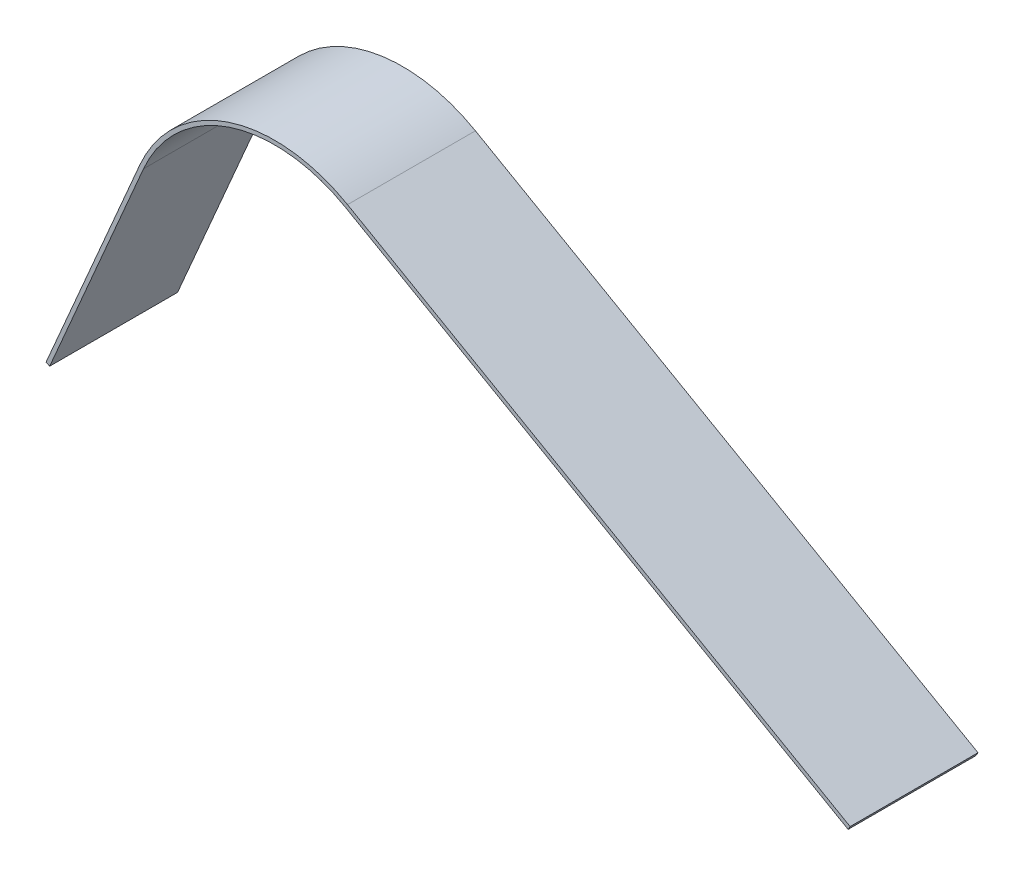
from build123d import *

# Parameters (mm, degrees)
BOSS_EXTRUDE1_DEPTH = 101.6


with BuildPart() as part:
    # Sketch1 → Boss-Extrude1 (new body)
    with BuildSketch(Plane.XY):
        with BuildLine():
            Line((-399.316491748, 228.260703583), (0, 0))
            Line((0, 0), (-0.00077889, -0.001362581))
            Line((-0.00077889, -0.001362581), (-1.575656634, -2.756434504))
            Line((-1.575656634, -2.756434504), (-400.892148382, 225.504269079))
            ThreePointArc((-400.892148382, 225.504269079), (-493.1499324, 234.616297749), (-561.407349132, 171.883110047))
            Line((-561.407349132, 171.883110047), (-635.980015722, -1.255959303))
            Line((-635.980015722, -1.255959303), (-638.896038909, 0))
            Line((-638.896038909, 0), (-564.32337232, 173.13906935))
            ThreePointArc((-564.32337232, 173.13906935), (-494.155915541, 237.627713183), (-399.316491748, 228.260703583))
        make_face()
    extrude(amount=BOSS_EXTRUDE1_DEPTH)


solid = part.part
